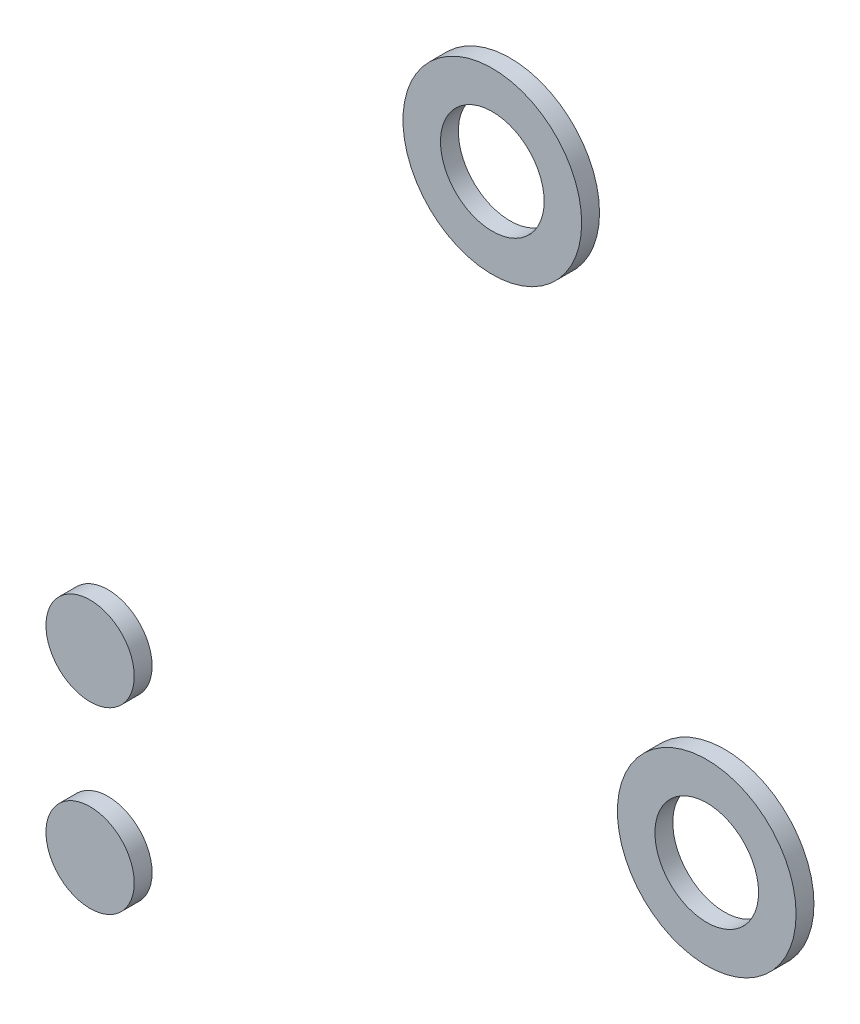
from build123d import *

# Parameters (mm, degrees)
SKETCH_6_R        = 2.47
EXTRUDE_5_DEPTH   = 1
EXTRUDE_5_2_DEPTH = 1
SKETCH_6_R_2      = 5
SKETCH_6_R_3      = 2.9
EXTRUDE_5_3_DEPTH = 1
EXTRUDE_5_4_DEPTH = 1


with BuildPart() as part:
    # 草图6 → 凸台-拉伸5 (new body)
    with BuildSketch(Plane.XY):
        with Locations((0, 10.02)):
            Circle(SKETCH_6_R)
    extrude(amount=EXTRUDE_5_DEPTH)


with BuildPart() as body_2:
    # 草图6 → Extrude 5 2 (new body)
    with BuildSketch(Plane.XY):
        Circle(SKETCH_6_R)
    extrude(amount=EXTRUDE_5_2_DEPTH)


with BuildPart() as body_3:
    # 草图6 → Extrude 5 3 (new body)
    with BuildSketch(Plane.XY):
        with Locations((22.51, 44.51)):
            Circle(SKETCH_6_R_2)
        with Locations((22.51, 44.51)):
            Circle(SKETCH_6_R_3, mode=Mode.SUBTRACT)
    extrude(amount=EXTRUDE_5_3_DEPTH)


with BuildPart() as body_4:
    # 草图6 → Extrude 5 4 (new body)
    with BuildSketch(Plane.XY):
        with Locations((34.51, 17.01)):
            Circle(SKETCH_6_R_2)
        with Locations((34.51, 17.01)):
            Circle(SKETCH_6_R_3, mode=Mode.SUBTRACT)
    extrude(amount=EXTRUDE_5_4_DEPTH)


solid = Compound([part.part, body_2.part, body_3.part, body_4.part])
